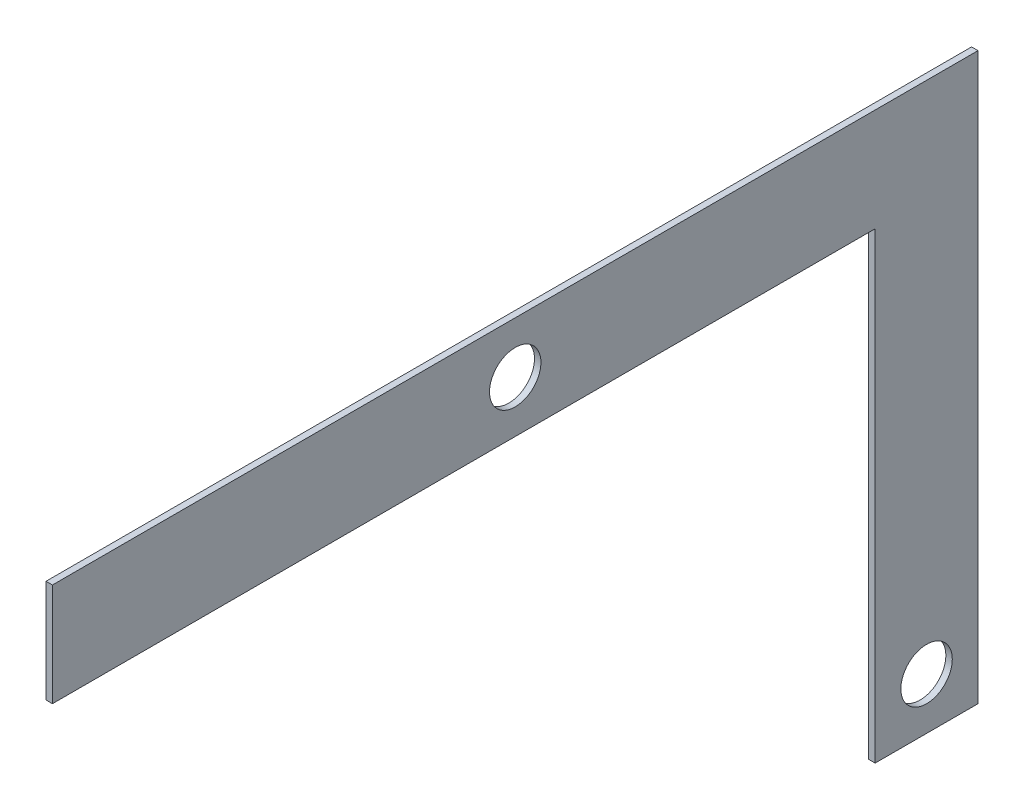
from build123d import *

# Parameters (mm, degrees)
SKETCH1_R           = 12.7
BOSS_EXTRUDE1_DEPTH = 3.175
SKETCH3_R           = 12.7
CUT_EXTRUDE1_DEPTH  = 342.736800221
SKETCH4_W           = 50.8
SKETCH4_H           = 228.6
CUT_EXTRUDE2_DEPTH  = 342.736800221


with BuildPart() as part:
    # Sketch1 → Boss-Extrude1 (new body)
    with BuildSketch(Plane(origin=(0, 0, 0), x_dir=(0, 0, -1), z_dir=(1, 0, 0))):
        Polygon((-228.6, 25.4), (228.6, 25.4), (228.6, -254), (177.8, -254), (177.8, -25.4), (-177.8, -25.4), (-177.8, -254), (-228.6, -254), align=None)
        Circle(SKETCH1_R, mode=Mode.SUBTRACT)
    extrude(amount=BOSS_EXTRUDE1_DEPTH)

    # Sketch3 → Cut-Extrude1 (cut, through all)
    with BuildSketch(Plane(origin=(3.175, 0, 0), x_dir=(0, 0, -1), z_dir=(1, 0, 0))):
        with Locations((-203.2, -228.6)):
            Circle(SKETCH3_R)
        with Locations((203.2, -228.6)):
            Circle(SKETCH3_R)
    extrude(amount=-CUT_EXTRUDE1_DEPTH, mode=Mode.SUBTRACT)

    # Sketch4 → Cut-Extrude2 (cut, through all)
    with BuildSketch(Plane(origin=(3.175, 0, 0), x_dir=(0, 0, -1), z_dir=(1, 0, 0))):
        with Locations((-203.2, -139.7)):
            Rectangle(SKETCH4_W, SKETCH4_H)
    extrude(amount=-CUT_EXTRUDE2_DEPTH, mode=Mode.SUBTRACT)


solid = part.part
